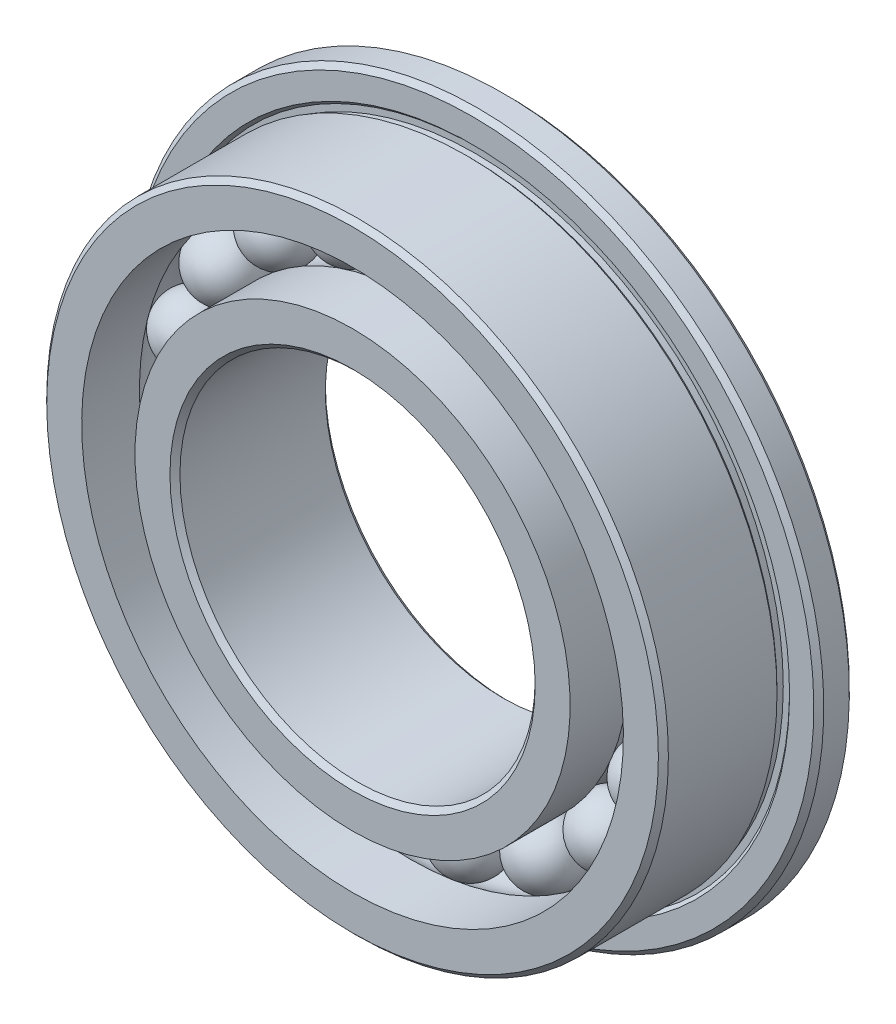
from build123d import *

# Parameters (mm, degrees)
FILLET1_SIZE      = 0.1125
FILLET2_SIZE      = 0.1125
CIRPATTERN3_COUNT = 19


with BuildPart() as part:
    # Sketch2 → Revolve1 (revolve)
    with BuildSketch(Plane(origin=(0, 0, 0), x_dir=(0, 0, -1), z_dir=(1, 0, 0))):
        with BuildLine():
            Line((1.75, 7.8), (0.95, 7.8))
            Line((0.95, 7.8), (0.95, 7.141421356))
            Line((0.95, 7.141421356), (1.020710678, 7.070710678))
            Line((1.020710678, 7.070710678), (1.020710678, 6.929289322))
            Line((1.020710678, 6.929289322), (0.879289322, 6.929289322))
            Line((0.879289322, 6.929289322), (0.808578644, 7))
            Line((0.808578644, 7), (-1.75, 7))
            Line((-1.75, 7), (-1.75, 6.1))
            Line((-1.75, 6.1), (-0.45, 6.1))
            ThreePointArc((-0.45, 6.1), (0, 6.25), (0.45, 6.1))
            Line((0.45, 6.1), (1.75, 6.1))
            Line((1.75, 6.1), (1.75, 7.8))
        make_face()
        with BuildLine():
            Line((1.75, 4), (-1.75, 4))
            Line((-1.75, 4), (-1.75, 4.9))
            Line((-1.75, 4.9), (-0.45, 4.9))
            ThreePointArc((-0.45, 4.9), (0, 4.75), (0.45, 4.9))
            Line((0.45, 4.9), (1.75, 4.9))
            Line((1.75, 4.9), (1.75, 4))
        make_face()
    revolve(axis=Axis((0, 0, 0), (0, 0, -1)))

    # Fillet1
    fillet1_edges = [part.edges().sort_by_distance(p)[0] for p in [
        (0, -7.8, -1.75),
        (0, -7.8, -0.95),
        (0, -7, 1.75),
    ]]
    chamfer(fillet1_edges, length=FILLET1_SIZE)

    # Fillet2
    fillet2_edges = [part.edges().sort_by_distance(p)[0] for p in [
        (0, -4, -1.75),
        (0, -4, 1.75),
    ]]
    chamfer(fillet2_edges, length=FILLET2_SIZE)


with BuildPart() as body_2:
    # Sketch7 → Revolve3 (revolve)
    with BuildSketch(Plane.XY):
        with BuildLine():
            Line((0, 6.25), (0, 4.75))
            ThreePointArc((0, 4.75), (-0.75, 5.5), (0, 6.25))
        make_face()
    revolve(axis=Axis((0, 6.25, 0), (0, -1, 0)))


with BuildPart() as cirpattern3_1:
    # CirPattern3: pattern copy
    add(body_2.part.rotate(Axis((0, 0, 0), (0, 0, -1)), 1 * 360 / CIRPATTERN3_COUNT))


with BuildPart() as cirpattern3_2:
    # CirPattern3: pattern copy
    add(body_2.part.rotate(Axis((0, 0, 0), (0, 0, -1)), 2 * 360 / CIRPATTERN3_COUNT))


with BuildPart() as cirpattern3_3:
    # CirPattern3: pattern copy
    add(body_2.part.rotate(Axis((0, 0, 0), (0, 0, -1)), 3 * 360 / CIRPATTERN3_COUNT))


with BuildPart() as cirpattern3_4:
    # CirPattern3: pattern copy
    add(body_2.part.rotate(Axis((0, 0, 0), (0, 0, -1)), 4 * 360 / CIRPATTERN3_COUNT))


with BuildPart() as cirpattern3_5:
    # CirPattern3: pattern copy
    add(body_2.part.rotate(Axis((0, 0, 0), (0, 0, -1)), 5 * 360 / CIRPATTERN3_COUNT))


with BuildPart() as cirpattern3_6:
    # CirPattern3: pattern copy
    add(body_2.part.rotate(Axis((0, 0, 0), (0, 0, -1)), 6 * 360 / CIRPATTERN3_COUNT))


with BuildPart() as cirpattern3_7:
    # CirPattern3: pattern copy
    add(body_2.part.rotate(Axis((0, 0, 0), (0, 0, -1)), 7 * 360 / CIRPATTERN3_COUNT))


with BuildPart() as cirpattern3_8:
    # CirPattern3: pattern copy
    add(body_2.part.rotate(Axis((0, 0, 0), (0, 0, -1)), 8 * 360 / CIRPATTERN3_COUNT))


with BuildPart() as cirpattern3_9:
    # CirPattern3: pattern copy
    add(body_2.part.rotate(Axis((0, 0, 0), (0, 0, -1)), 9 * 360 / CIRPATTERN3_COUNT))


with BuildPart() as cirpattern3_10:
    # CirPattern3: pattern copy
    add(body_2.part.rotate(Axis((0, 0, 0), (0, 0, -1)), 10 * 360 / CIRPATTERN3_COUNT))


with BuildPart() as cirpattern3_11:
    # CirPattern3: pattern copy
    add(body_2.part.rotate(Axis((0, 0, 0), (0, 0, -1)), 11 * 360 / CIRPATTERN3_COUNT))


with BuildPart() as cirpattern3_12:
    # CirPattern3: pattern copy
    add(body_2.part.rotate(Axis((0, 0, 0), (0, 0, -1)), 12 * 360 / CIRPATTERN3_COUNT))


with BuildPart() as cirpattern3_13:
    # CirPattern3: pattern copy
    add(body_2.part.rotate(Axis((0, 0, 0), (0, 0, -1)), 13 * 360 / CIRPATTERN3_COUNT))


with BuildPart() as cirpattern3_14:
    # CirPattern3: pattern copy
    add(body_2.part.rotate(Axis((0, 0, 0), (0, 0, -1)), 14 * 360 / CIRPATTERN3_COUNT))


with BuildPart() as cirpattern3_15:
    # CirPattern3: pattern copy
    add(body_2.part.rotate(Axis((0, 0, 0), (0, 0, -1)), 15 * 360 / CIRPATTERN3_COUNT))


with BuildPart() as cirpattern3_16:
    # CirPattern3: pattern copy
    add(body_2.part.rotate(Axis((0, 0, 0), (0, 0, -1)), 16 * 360 / CIRPATTERN3_COUNT))


with BuildPart() as cirpattern3_17:
    # CirPattern3: pattern copy
    add(body_2.part.rotate(Axis((0, 0, 0), (0, 0, -1)), 17 * 360 / CIRPATTERN3_COUNT))


with BuildPart() as cirpattern3_18:
    # CirPattern3: pattern copy
    add(body_2.part.rotate(Axis((0, 0, 0), (0, 0, -1)), 18 * 360 / CIRPATTERN3_COUNT))


solid = Compound([part.part, body_2.part, cirpattern3_1.part, cirpattern3_2.part, cirpattern3_3.part, cirpattern3_4.part, cirpattern3_5.part, cirpattern3_6.part, cirpattern3_7.part, cirpattern3_8.part, cirpattern3_9.part, cirpattern3_10.part, cirpattern3_11.part, cirpattern3_12.part, cirpattern3_13.part, cirpattern3_14.part, cirpattern3_15.part, cirpattern3_16.part, cirpattern3_17.part, cirpattern3_18.part])
